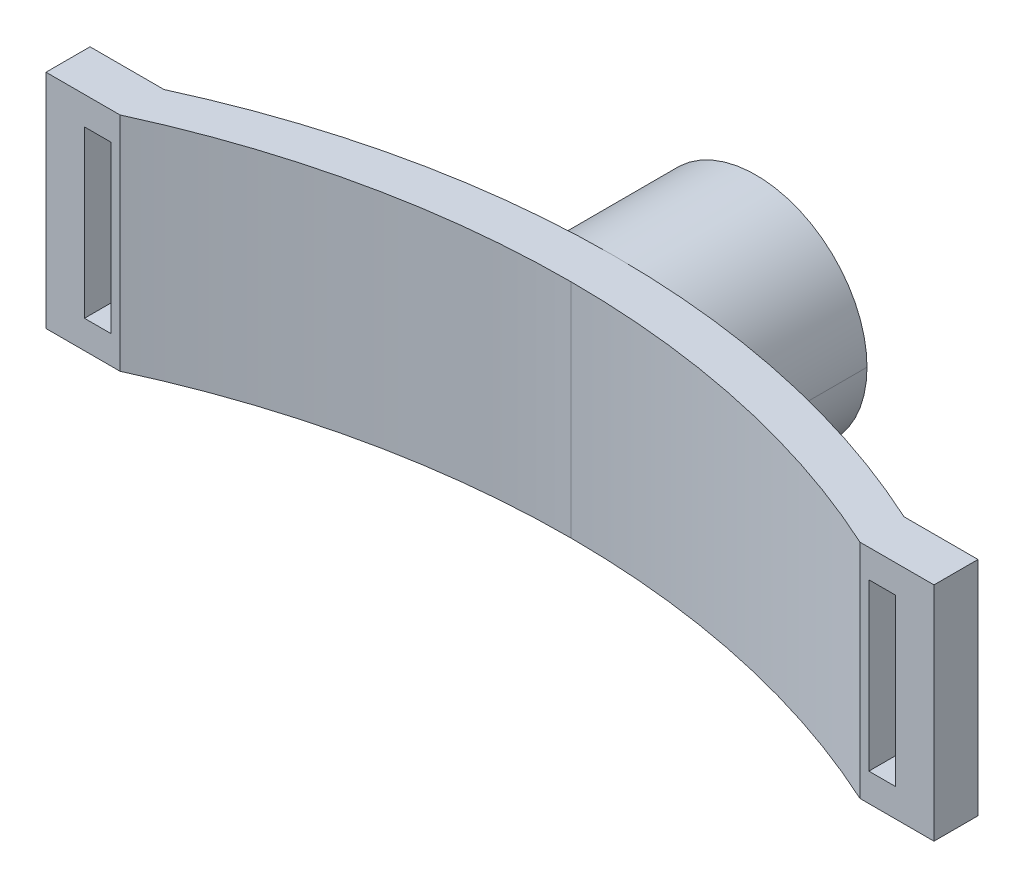
from build123d import *

# Parameters (mm, degrees)
BOSS_EXTRUDE1_START         = -15
BOSS_EXTRUDE1_DEPTH         = 30
BOSS_EXTRUDE1_START_2       = -12.7
BOSS_EXTRUDE1_2_OUTLINE_W   = 10
BOSS_EXTRUDE1_2_OUTLINE_H   = 5.949524979
BOSS_EXTRUDE1_2_DEPTH       = 25.4
BOSS_EXTRUDE1_3_OUTLINE_R   = 15
BOSS_EXTRUDE1_3_OUTLINE_R_2 = 4.55
BOSS_EXTRUDE1_3_DEPTH       = 19.994560744
SKETCH4_W                   = 3.6
SKETCH4_H                   = 22.4
CUT_EXTRUDE1_DEPTH          = 6
BOSS_EXTRUDE2_REACH         = 73.536
BOSS_EXTRUDE2_END_RADIUS    = 119.634966004
SKETCH9_R                   = 6.57997386
SKETCH9_R_2                 = 3.45
SKETCH10_W                  = 5.949524979
SKETCH10_H                  = 2.3
BOSS_EXTRUDE3_DEPTH         = 10
SKETCH11_W                  = 5.949524979
SKETCH11_H                  = 30
BOSS_EXTRUDE4_DEPTH         = 10
SKETCH13_W                  = 3.6
SKETCH13_H                  = 22.4
CUT_EXTRUDE2_DEPTH          = 10
SKETCH15_R                  = 6
CUT_EXTRUDE3_DEPTH          = 5


with BuildPart() as part:
    # Boss-Extrude1: read off the stored shape, not the designer's step
    # Boss-Extrude1 outline → Boss-Extrude1 (new body)
    with BuildSketch(Plane(origin=(0, 0, 0), x_dir=(1, 0, 0), z_dir=(0, 1, 0)).offset(BOSS_EXTRUDE1_START)):
        with BuildLine():
            Line((-50, -30), (-50, -35.949524979))
            ThreePointArc((-50, -35.949524979), (-25.592440765, -27.769436157), (0, -25))
            ThreePointArc((0, -25), (25.592440765, -27.769436157), (50, -35.949524979))
            Line((50, -35.949524979), (50, -30))
            ThreePointArc((50, -30), (27.810549479, -22.327809439), (4.550000287, -19.13702996))
            ThreePointArc((4.550000287, -19.13702996), (2.275411741, -19.072115713), (0, -19.050475021))
            ThreePointArc((0, -19.050475021), (-25.592440765, -21.819911178), (-50, -30))
        make_face()
    extrude(amount=BOSS_EXTRUDE1_DEPTH)

    # Boss-Extrude1 2 outline → Boss-Extrude1 2 (add)
    with BuildSketch(Plane(origin=(0, 0, 0), x_dir=(1, 0, 0), z_dir=(0, 1, 0)).offset(BOSS_EXTRUDE1_START_2)):
        with Locations((-55, -32.97476249)):
            Rectangle(BOSS_EXTRUDE1_2_OUTLINE_W, BOSS_EXTRUDE1_2_OUTLINE_H)
    extrude(amount=BOSS_EXTRUDE1_2_DEPTH)

    # Boss-Extrude1 3 outline → Boss-Extrude1 3 (add)
    with BuildSketch(Plane.XY):
        Circle(BOSS_EXTRUDE1_3_OUTLINE_R)
        Circle(BOSS_EXTRUDE1_3_OUTLINE_R_2, mode=Mode.SUBTRACT)
    extrude(amount=BOSS_EXTRUDE1_3_DEPTH)

    # Sketch4 → Cut-Extrude1 (cut)
    with BuildSketch(Plane.XY.offset(35.949524979)):
        with Locations((-53, 0)):
            Rectangle(SKETCH4_W, SKETCH4_H)
    extrude(amount=-CUT_EXTRUDE1_DEPTH, mode=Mode.SUBTRACT)

    # Boss-Extrude2: up to this cylinder (the profile starts outside it)
    boss_extrude2_end = Plane(origin=(0, 0, 138.685441025), z_dir=(0, -1, 0)) * Cylinder(BOSS_EXTRUDE2_END_RADIUS, 387.341932008, mode=Mode.PRIVATE)
    # Sketch9 → Boss-Extrude2 (add, up to the surface)
    with BuildSketch(Plane(origin=(0, 0, 0), x_dir=(-1, 0, 0), z_dir=(0, 0, -1)), mode=Mode.PRIVATE) as boss_extrude2_sk1:
        Circle(SKETCH9_R)
        Circle(SKETCH9_R_2, mode=Mode.SUBTRACT)
    boss_extrude2_tool1 = extrude(boss_extrude2_sk1.sketch, amount=-BOSS_EXTRUDE2_REACH, mode=Mode.PRIVATE) - boss_extrude2_end
    add(boss_extrude2_tool1.solids().sort_by_distance((6.393864, 0, 0))[0])

    # Sketch10 → Boss-Extrude3 (add)
    with BuildSketch(Plane.ZY.offset(50)):
        with Locations((32.97476249, 13.85)):
            Rectangle(SKETCH10_W, SKETCH10_H)
        with Locations((32.97476249, -13.85)):
            Rectangle(SKETCH10_W, SKETCH10_H)
    extrude(amount=BOSS_EXTRUDE3_DEPTH)

    # Sketch11 → Boss-Extrude4 (add)
    with BuildSketch(Plane(origin=(50, 0, 0), x_dir=(0, 0, -1), z_dir=(1, 0, 0))):
        with Locations((-32.97476249, 0)):
            Rectangle(SKETCH11_W, SKETCH11_H)
    extrude(amount=BOSS_EXTRUDE4_DEPTH)

    # Sketch13 → Cut-Extrude2 (cut)
    with BuildSketch(Plane.XY.offset(35.949524979)):
        with Locations((53, 0)):
            Rectangle(SKETCH13_W, SKETCH13_H)
    extrude(amount=-CUT_EXTRUDE2_DEPTH, mode=Mode.SUBTRACT)

    # Sketch15 → Cut-Extrude3 (cut)
    with BuildSketch(Plane(origin=(0, 0, 0), x_dir=(-1, 0, 0), z_dir=(0, 0, -1))):
        Circle(SKETCH15_R)
    extrude(amount=-CUT_EXTRUDE3_DEPTH, mode=Mode.SUBTRACT)


solid = part.part
